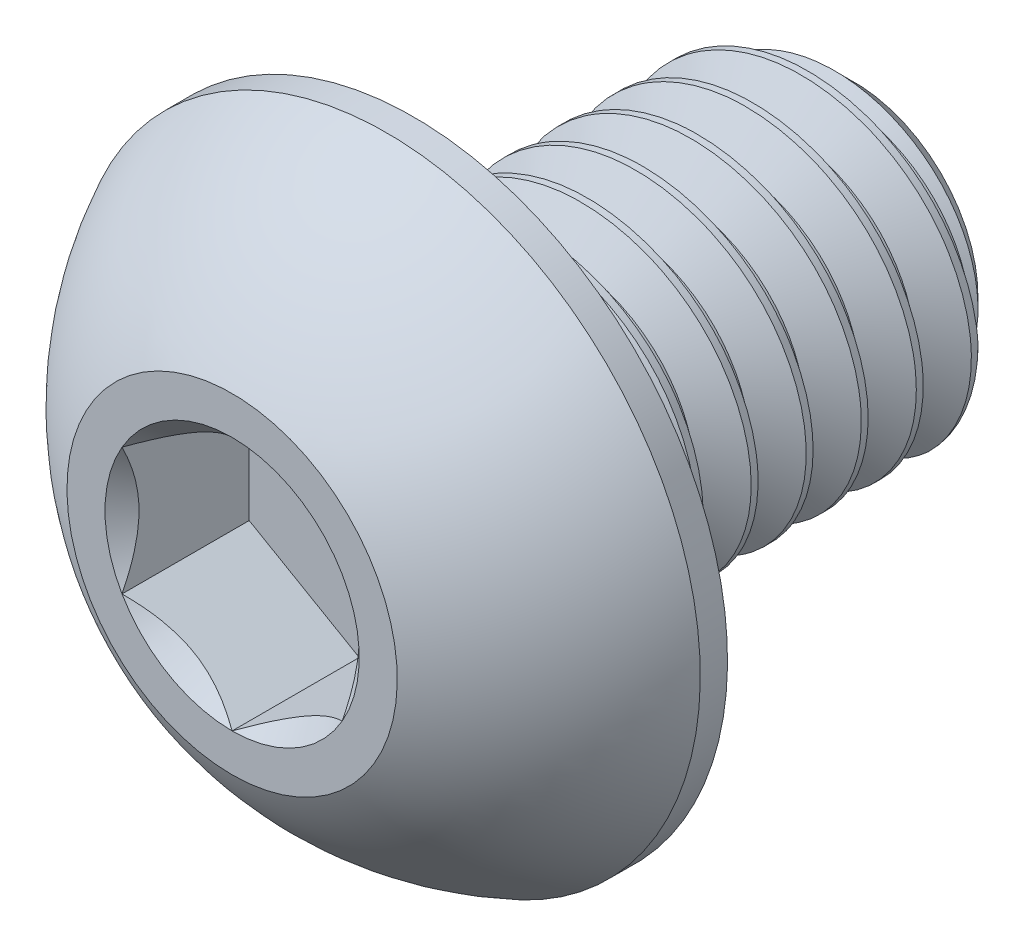
from build123d import *

# Parameters (mm, degrees)
CUT_EXTRUDE2_DEPTH = 1.155
CUT_SWEEP2_PITCH   = 0.5


# Read off the part's stored shape, not the designer's step: Split1, Boss-Extrude1
with BuildPart() as part:
    # Sketch10 → Revolve3 (revolve)
    with BuildSketch(Plane(origin=(0, 0, 0), x_dir=(0, 0, -1), z_dir=(1, 0, 0)), mode=Mode.PRIVATE) as revolve3_sk:
        Polygon((1.625, 1.5), (2, 1.125), (2, 0), (-2, 0), (-2, 1.5), align=None)
    revolve(revolve3_sk.sketch.rotate(Axis((0, 0, 3.65), (0, 0, -1)), 180), axis=Axis((0, 0, 3.65), (0, 0, -1)))

    # Sketch7 → Revolve2 (revolve)
    with BuildSketch(Plane(origin=(0, 0, 0), x_dir=(0, 0, -1), z_dir=(1, 0, 0)), mode=Mode.PRIVATE) as revolve2_sk:
        with BuildLine():
            Line((-2.2475, 2.85), (-2, 2.85))
            Line((-2, 2.85), (-2, 0))
            Line((-2, 0), (-3.65, 0))
            Line((-3.65, 0), (-3.65, 1.5))
            ThreePointArc((-3.65, 1.5), (-3.05487489, 2.285251969), (-2.2475, 2.85))
        make_face()
    revolve(revolve2_sk.sketch.rotate(Axis((0, 0, 3.65), (0, 0, -1)), 180), axis=Axis((0, 0, 3.65), (0, 0, -1)))

    # Sketch5 → Cut-Extrude2 (cut)
    with BuildSketch(Plane.XY.offset(3.65)):
        Polygon((1, -0.577350269), (1, 0.577350269), (0, 1.154700538), (-1, 0.577350269), (-1, -0.577350269), (0, -1.154700538), align=None)
    extrude(amount=-CUT_EXTRUDE2_DEPTH, mode=Mode.SUBTRACT)

    # Cut-Extrude3 cone 1 section (through the dimple's axis) → Cut-Extrude3 (revolve, cut)
    with BuildSketch(Plane(origin=(0, 0, 3.65), x_dir=(0, -1, 0), z_dir=(1, 0, 0))):
        Polygon((0, 0), (1.154700538, 0), (0, 1.154700538), align=None)
    revolve(axis=Axis((0, 0, 3.65), (0, 0, -1)), mode=Mode.SUBTRACT)


with BuildPart() as body_2:
    # Split1: the piece on the far side of the plane
    add(part.part)
    split(bisect_by=Plane.XY.offset(2), keep=Keep.BOTTOM)

    # Cut-Sweep2: the profile of Sketch12 screwed along a right-hand helix of 11.3 turns, 6 arcs to a turn; built about Z, then put on its axis
    cut_sweep2_z = Axis((0, 0, 0), (0, 0, 1))
    cut_sweep2_corners = [(1.175240474, 0, -0.1875), (1.175240474, 0, -0.25), (1.527063294, 0, -0.453125), (1.527063294, 0, 0.015625)]
    with BuildLine(mode=Mode.PRIVATE) as cut_sweep2_profile:
        Line(cut_sweep2_corners[0], cut_sweep2_corners[1])
        Line(cut_sweep2_corners[1], cut_sweep2_corners[2])
        Line(cut_sweep2_corners[2], cut_sweep2_corners[3])
        Line(cut_sweep2_corners[3], cut_sweep2_corners[0])
    cut_sweep2_cap = Face(cut_sweep2_profile.wire())
    cut_sweep2_turn_angles = [0, 30, 60, 90, 120, 150, 180, 210, 240, 270, 300, 330, 360]
    cut_sweep2_turn_weights = [1, 0.8660254037844387, 1, 0.8660254037844387, 1, 0.8660254037844387, 1, 0.8660254037844387, 1, 0.8660254037844387, 1, 0.8660254037844387, 1]
    cut_sweep2_turn_rails = [Edge.make_bspline([Vector(p[0], p[1], 0).rotate(cut_sweep2_z, cut_sweep2_turn_angles[k]) / cut_sweep2_turn_weights[k] + Vector(0, 0, p[2] + CUT_SWEEP2_PITCH * cut_sweep2_turn_angles[k] / 360) for k in range(13)], [0, 0, 0, 1, 1, 2, 2, 3, 3, 4, 4, 5, 5, 6, 6, 6], 2, cut_sweep2_turn_weights) for p in cut_sweep2_corners]
    cut_sweep2_turn_sides = [Face.make_surface_from_curves(cut_sweep2_turn_rails[p[0]], cut_sweep2_turn_rails[p[1]]) for p in [(0, 1), (1, 2), (2, 3), (3, 0)]]
    cut_sweep2_last_angles = [3960, 3990, 4020, 4044, 4068]
    cut_sweep2_last_weights = [1, 0.8660254037844387, 1, 0.913545457642659, 1]
    cut_sweep2_last_rails = [Edge.make_bspline([Vector(p[0], p[1], 0).rotate(cut_sweep2_z, cut_sweep2_last_angles[k]) / cut_sweep2_last_weights[k] + Vector(0, 0, p[2] + CUT_SWEEP2_PITCH * cut_sweep2_last_angles[k] / 360) for k in range(5)], [0, 0, 0, 1, 1, 2, 2, 2], 2, cut_sweep2_last_weights) for p in cut_sweep2_corners]
    cut_sweep2_last_sides = [Face.make_surface_from_curves(cut_sweep2_last_rails[p[0]], cut_sweep2_last_rails[p[1]]) for p in [(0, 1), (1, 2), (2, 3), (3, 0)]]
    cut_sweep2 = Plane(origin=(0, 0, -2), x_dir=(0, 1, 0), z_dir=(0, 0, 1)) * Solid(Shell([*[p.moved(Location((0, 0, CUT_SWEEP2_PITCH * i))) for i in range(11) for p in cut_sweep2_turn_sides], *cut_sweep2_last_sides, cut_sweep2_cap, cut_sweep2_cap.rotate(cut_sweep2_z, 4068).moved(Location((0, 0, CUT_SWEEP2_PITCH * 4068 / 360)))]))
    add(cut_sweep2, mode=Mode.SUBTRACT)


with BuildPart() as part_1:
    add(part.part)

    # Split1
    split(bisect_by=Plane.XY.offset(2), keep=Keep.TOP)

    add(body_2.part)  # Boss-Extrude1 merges body 2
    # Boss-Extrude1 outline → Boss-Extrude1 (revolve)
    with BuildSketch(Plane.XZ):
        Polygon((1.175240474, 2), (1.175240474, 1.675240474), (1.5, 2), align=None)
    revolve(axis=Axis((0, 0, 0), (0, 0, 1)))


solid = part_1.part
